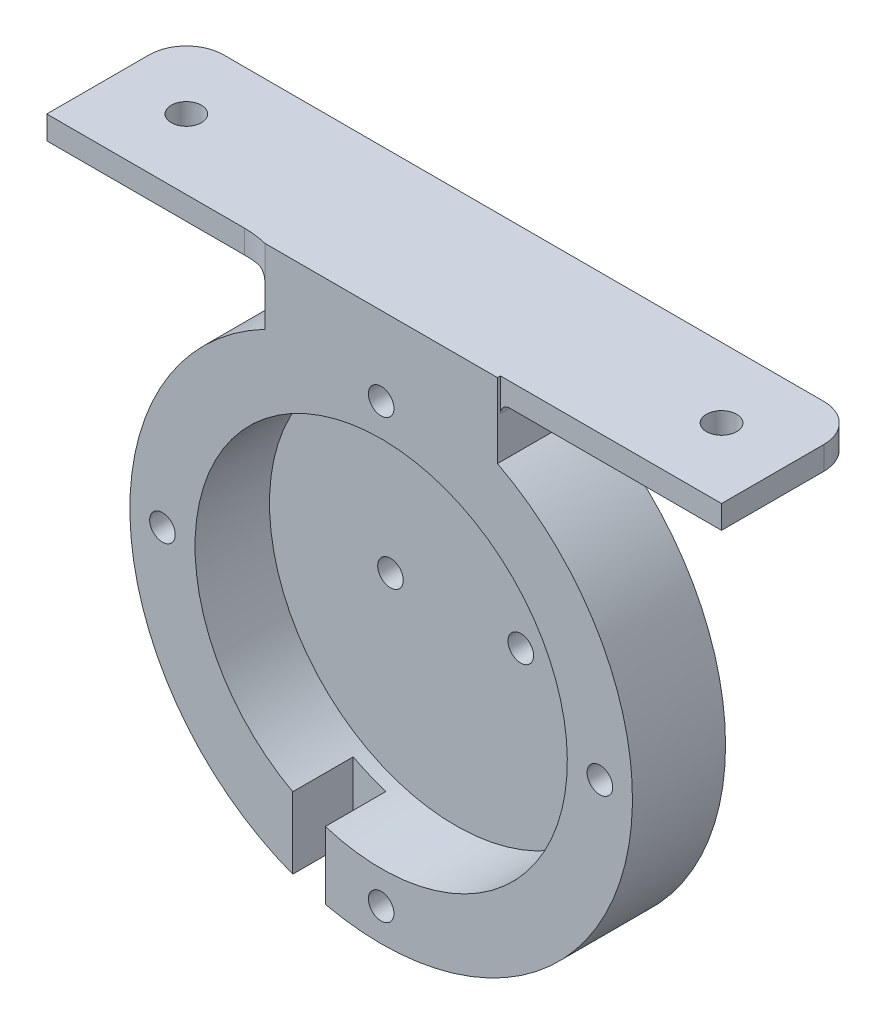
from build123d import *

# Parameters (mm, degrees)
SKETCH1_R               = 27
SKETCH1_R_2             = 1.375
SKETCH1_R_3             = 20
BOSS_EXTRUDE1_DEPTH     = 10
SKETCH3_R               = 20
SKETCH3_R_2             = 1.375
BOSS_EXTRUDE2_DEPTH     = 2
BOSS_EXTRUDE3_DEPTH     = 6
CUT_EXTRUDE1_REACH      = 44.996
CUT_EXTRUDE1_END_RADIUS = 27
SKETCH4_W               = 3.5
SKETCH4_H               = 9.337272122
SKETCH6_W               = 25
SKETCH6_H               = 15.32
BOSS_EXTRUDE4_DEPTH     = 2.5
SKETCH7_R               = 1.625
BOSS_EXTRUDE5_DEPTH     = 2.5
FILLET2_R               = 10
FILLET3_R               = 1


with BuildPart() as part:
    # Sketch1 → Boss-Extrude1 (new body)
    with BuildSketch(Plane.XY):
        Circle(SKETCH1_R)
        with Locations((0, 23.5)):
            Circle(SKETCH1_R_2, mode=Mode.SUBTRACT)
        with Locations((23.5, 0)):
            Circle(SKETCH1_R_2, mode=Mode.SUBTRACT)
        with Locations((0, -23.5)):
            Circle(SKETCH1_R_2, mode=Mode.SUBTRACT)
        with Locations((-23.5, 0)):
            Circle(SKETCH1_R_2, mode=Mode.SUBTRACT)
        Circle(SKETCH1_R_3, mode=Mode.SUBTRACT)
    extrude(amount=BOSS_EXTRUDE1_DEPTH)

    # Sketch3 → Boss-Extrude2 (add)
    with BuildSketch(Plane.XY):
        Circle(SKETCH3_R)
        with Locations((-7, 0)):
            Circle(SKETCH3_R_2, mode=Mode.SUBTRACT)
        with Locations((7, 0)):
            Circle(SKETCH3_R_2, mode=Mode.SUBTRACT)
    extrude(amount=BOSS_EXTRUDE2_DEPTH)

    # Sketch5 → Boss-Extrude3 (add)
    with BuildSketch(Plane.XY.offset(10)):
        Polygon((-12.5, 23.932195888), (-4.251935746, 23.932195888), (0, 26.25446737), (4.267780323, 23.932195888), (12.5, 23.932195888), (12.5, 31.932195888), (-12.5, 31.932195888), align=None)
    extrude(amount=-BOSS_EXTRUDE3_DEPTH)

    # Cut-Extrude1: up to this cylinder (the profile starts inside it)
    cut_extrude1_end = Plane(origin=(0, 0, 8.168636), z_dir=(0, 0, -1)) * Cylinder(CUT_EXTRUDE1_END_RADIUS, 144.992, mode=Mode.PRIVATE)
    # Sketch4 → Cut-Extrude1 (cut, up to the surface)
    with BuildSketch(Plane(origin=(0, 0, 0), x_dir=(1, 0, 0), z_dir=(0, 1, 0)), mode=Mode.PRIVATE) as cut_extrude1_sk1:
        with Locations((-7.75, -8.168636061)):
            Rectangle(SKETCH4_W, SKETCH4_H)
    cut_extrude1_tool1 = extrude(cut_extrude1_sk1.sketch, amount=-CUT_EXTRUDE1_REACH, mode=Mode.PRIVATE) & cut_extrude1_end
    add(cut_extrude1_tool1.solids().sort_by_distance((-7.75, 0, 8.168636))[0], mode=Mode.SUBTRACT)

    # Sketch6 → Boss-Extrude4 (add)
    with BuildSketch(Plane(origin=(0, 31.932195888, 0), x_dir=(1, 0, 0), z_dir=(0, 1, 0))):
        with Locations((0, -2.34)):
            Rectangle(SKETCH6_W, SKETCH6_H)
    boss_extrude4 = extrude(amount=-BOSS_EXTRUDE4_DEPTH)

    # Sketch7 → Boss-Extrude5 (add)
    with BuildSketch(Plane(origin=(0, 31.932195888, 0), x_dir=(1, 0, 0), z_dir=(0, 1, 0))):
        with BuildLine():
            Line((-36.25, -9.68), (-28.75, -9.68))
            Line((-28.75, -9.68), (0, -9.68))
            Line((0, -9.68), (0, 5.32))
            Line((0, 5.32), (-32.25, 5.32))
            ThreePointArc((-32.25, 5.32), (-35.078427125, 4.148427125), (-36.25, 1.32))
            Line((-36.25, 1.32), (-36.25, -2.18))
            Line((-36.25, -2.18), (-36.25, -9.68))
        make_face()
        with Locations(Location((-28.75, -2.18, 0), (0, 0, 270))):
            Circle(SKETCH7_R, mode=Mode.SUBTRACT)
    boss_extrude5 = extrude(amount=-BOSS_EXTRUDE5_DEPTH)

    # Fillet2
    # the kernel refuses this fillet: 10 mm, written as the material it adds along each edge
    with BuildSketch(Plane(origin=(-12.5, 29.432195888, 9.68), x_dir=(-1, 0, 0), z_dir=(0, 1, 0))) as fillet2_piece_1:
        with BuildLine():
            CenterArc((2.509501943, 10), FILLET2_R, 255.466253099, 14.533746901)
            Line((0, 0.32), (-0.050190039, 0.1264))
            ThreePointArc((-0.050190039, 0.1264), (-0.2, 0.16), (-0.2, 0))
            Line((-0.2, 0), (0, -0.2))
            Line((0, -0.2), (2.509501943, -0.2))
            Line((2.509501943, -0.2), (2.509501943, 0))
        make_face()
    extrude(amount=2.5)

    # Mirror1: Boss-Extrude4, Boss-Extrude5 across plane
    add(boss_extrude4.mirror(Plane(origin=(0, 0, 0), x_dir=(0, 0, 1), z_dir=(1, 0, 0))))
    add(boss_extrude5.mirror(Plane(origin=(0, 0, 0), x_dir=(0, 0, 1), z_dir=(1, 0, 0))))

    # Fillet3
    # the kernel refuses this fillet: 1 mm, written as the material it adds along each edge
    with BuildSketch(Plane(origin=(-12.5, 29.432195888, 4), x_dir=(0, -1, 0), z_dir=(0, 0, 1))) as fillet3_piece_1_section:
        with BuildLine():
            CenterArc((FILLET3_R, -FILLET3_R), FILLET3_R, 90, 90)
            Line((0, -FILLET3_R), (0, 0))
            Line((0, 0), (FILLET3_R, 0))
        make_face()
    fillet3_piece_1 = extrude(amount=6, mode=Mode.PRIVATE)
    fillet3_piece_1 = fillet3_piece_1 - Plane(origin=(-15.009501943, 29.204760134, 19.68), x_dir=(-1, 0, 0), z_dir=(0, -1, 0)) * Cylinder(10, 16, mode=Mode.PRIVATE)
    add(fillet3_piece_1)
    with BuildSketch(Plane(origin=(12.5, 29.432195888, 9.68), x_dir=(0, -1, 0), z_dir=(0, 0, -1))) as fillet3_piece_2:
        with BuildLine():
            CenterArc((FILLET3_R, -FILLET3_R), FILLET3_R, 90, 90)
            Line((0, -FILLET3_R), (0, 0))
            Line((0, 0), (FILLET3_R, 0))
        make_face()
    extrude(amount=5.68)
    with BuildSketch(Plane(origin=(12.5, 29.432195888, 4), x_dir=(0, -1, 0), z_dir=(-1, 0, 0))) as fillet3_piece_3:
        with BuildLine():
            CenterArc((FILLET3_R, -FILLET3_R), FILLET3_R, 90, 90)
            Line((0, -FILLET3_R), (0, 0))
            Line((0, 0), (FILLET3_R, 0))
        make_face()
    extrude(amount=25)
    with BuildSketch(Plane(origin=(-12.5, 29.432195888, 1.5), x_dir=(0, -1, 0), z_dir=(0, 0, 1))) as fillet3_piece_4a_section:
        with BuildLine():
            CenterArc((FILLET3_R, -FILLET3_R), FILLET3_R, 90, 90)
            Line((0, -FILLET3_R), (0, 0))
            Line((0, 0), (FILLET3_R, 0))
        make_face()
    fillet3_piece_4a = extrude(amount=8.5, mode=Mode.PRIVATE)
    fillet3_piece_4a = split(fillet3_piece_4a, bisect_by=Plane(origin=(-12.726395114, 29.205800773, 4), z_dir=(0, 0, -1)), keep=Keep.TOP, mode=Mode.PRIVATE)
    with BuildSketch(Plane(origin=(12.5, 29.432195888, 4), x_dir=(0, -1, 0), z_dir=(-1, 0, 0))) as fillet3_piece_4b_section:
        with BuildLine():
            CenterArc((FILLET3_R, -FILLET3_R), FILLET3_R, 90, 90)
            Line((0, -FILLET3_R), (0, 0))
            Line((0, 0), (FILLET3_R, 0))
        make_face()
    fillet3_piece_4b = extrude(amount=27.5, mode=Mode.PRIVATE)
    fillet3_piece_4b = split(fillet3_piece_4b, bisect_by=Plane(origin=(-12.5, 29.205800773, 3.773604886), z_dir=(-1, 0, 0)), keep=Keep.TOP, mode=Mode.PRIVATE)
    fillet3_piece_4 = fillet3_piece_4a & fillet3_piece_4b
    add(fillet3_piece_4)
    with BuildSketch(Plane(origin=(12.5, 29.432195888, 9.68), x_dir=(0, -1, 0), z_dir=(0, 0, -1))) as fillet3_piece_5a_section:
        with BuildLine():
            CenterArc((FILLET3_R, -FILLET3_R), FILLET3_R, 90, 90)
            Line((0, -FILLET3_R), (0, 0))
            Line((0, 0), (FILLET3_R, 0))
        make_face()
    fillet3_piece_5a = extrude(amount=8.18, mode=Mode.PRIVATE)
    fillet3_piece_5a = split(fillet3_piece_5a, bisect_by=Plane(origin=(12.726395114, 29.205800773, 4), z_dir=(0, 0, -1)), keep=Keep.TOP, mode=Mode.PRIVATE)
    with BuildSketch(Plane(origin=(15, 29.432195888, 4), x_dir=(0, -1, 0), z_dir=(-1, 0, 0))) as fillet3_piece_5b_section:
        with BuildLine():
            CenterArc((FILLET3_R, -FILLET3_R), FILLET3_R, 90, 90)
            Line((0, -FILLET3_R), (0, 0))
            Line((0, 0), (FILLET3_R, 0))
        make_face()
    fillet3_piece_5b = extrude(amount=27.5, mode=Mode.PRIVATE)
    fillet3_piece_5b = split(fillet3_piece_5b, bisect_by=Plane(origin=(12.5, 29.205800773, 3.773604886), z_dir=(1, 0, 0)), keep=Keep.TOP, mode=Mode.PRIVATE)
    fillet3_piece_5 = fillet3_piece_5a & fillet3_piece_5b
    add(fillet3_piece_5)


solid = part.part
